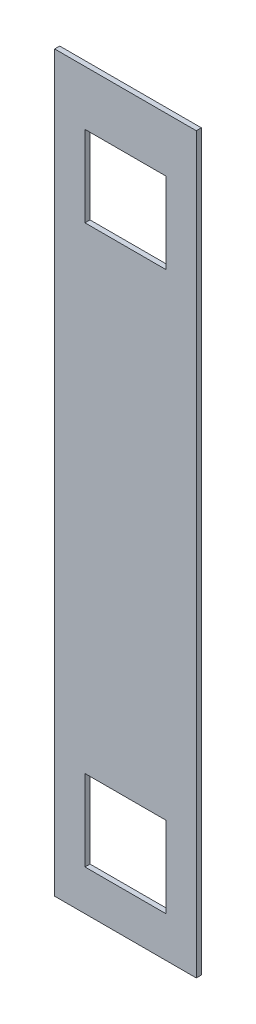
from build123d import *

# Parameters (mm, degrees)
SKETCH1_W           = 177.8
SKETCH1_H           = 920.75
BOSS_EXTRUDE1_DEPTH = 6.35
CUT_EXTRUDE1_REACH  = 470.923
SKETCH2_W           = 101.6
SKETCH2_H           = 101.6


with BuildPart() as part:
    # Sketch1 → Boss-Extrude1 (new body)
    with BuildSketch(Plane.XY):
        Rectangle(SKETCH1_W, SKETCH1_H)
    extrude(amount=BOSS_EXTRUDE1_DEPTH)

    # Sketch2 → Cut-Extrude1 (cut, up to next)
    with BuildSketch(Plane(origin=(0, 0, 0), x_dir=(-1, 0, 0), z_dir=(0, 0, -1)), mode=Mode.PRIVATE) as cut_extrude1_sk1:
        with Locations((0, -358.775)):
            Rectangle(SKETCH2_W, SKETCH2_H)
    cut_extrude1_tool1 = extrude(cut_extrude1_sk1.sketch, amount=-CUT_EXTRUDE1_REACH, mode=Mode.PRIVATE) & part.part
    # Sketch2 → Cut-Extrude1 (cut, up to next)
    with BuildSketch(Plane(origin=(0, 0, 0), x_dir=(-1, 0, 0), z_dir=(0, 0, -1)), mode=Mode.PRIVATE) as cut_extrude1_sk2:
        with Locations((0, 341.225)):
            Rectangle(SKETCH2_W, SKETCH2_H)
    cut_extrude1_tool2 = extrude(cut_extrude1_sk2.sketch, amount=-CUT_EXTRUDE1_REACH, mode=Mode.PRIVATE) & part.part
    add(cut_extrude1_tool1.solids().sort_by_distance((0, -358.775, 0))[0], mode=Mode.SUBTRACT)
    add(cut_extrude1_tool2.solids().sort_by_distance((0, 341.225, 0))[0], mode=Mode.SUBTRACT)


solid = part.part
